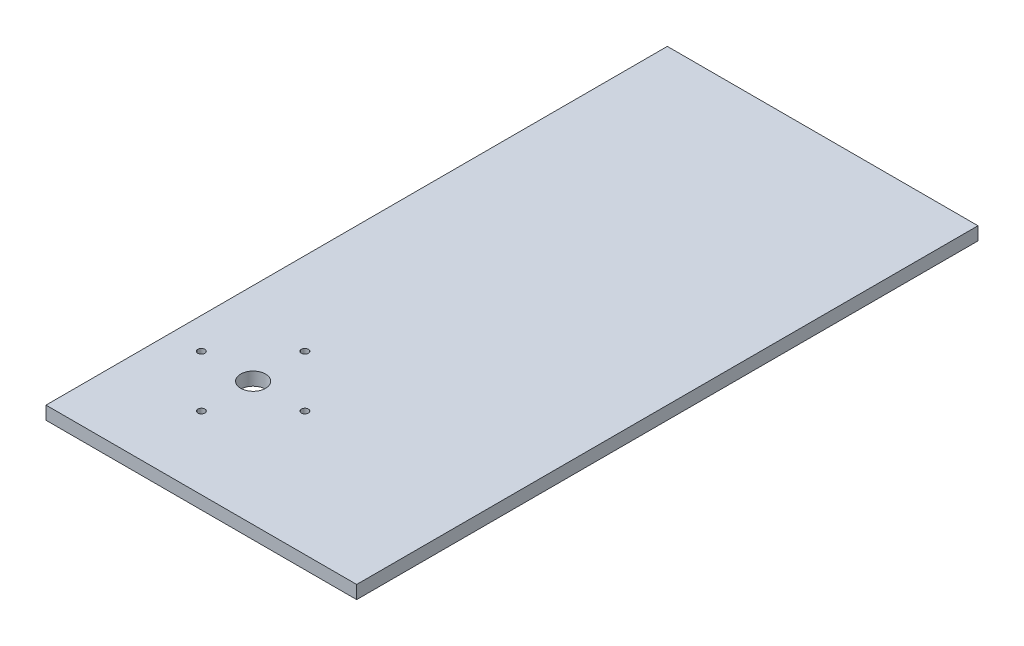
from build123d import *

# Parameters (mm, degrees)
SKETCH1_W           = 150
SKETCH1_H           = 300
BOSS_EXTRUDE1_DEPTH = 6.35
SKETCH2_R           = 6
SKETCH2_R_2         = 1.7
CUT_EXTRUDE1_DEPTH  = 168.825273722


with BuildPart() as part:
    # Sketch1 → Boss-Extrude1 (new body)
    with BuildSketch(Plane(origin=(0, 0, 0), x_dir=(1, 0, 0), z_dir=(0, 1, 0))):
        Rectangle(SKETCH1_W, SKETCH1_H)
    extrude(amount=BOSS_EXTRUDE1_DEPTH)

    # Sketch2 → Cut-Extrude1 (cut, through all)
    with BuildSketch(Plane(origin=(0, 6.35, 0), x_dir=(1, 0, 0), z_dir=(0, 1, 0))):
        with Locations((-35, -90)):
            Circle(SKETCH2_R)
        with Locations((-35, -65)):
            Circle(SKETCH2_R_2)
        with Locations((-10, -90)):
            Circle(SKETCH2_R_2)
        with Locations((-35, -115)):
            Circle(SKETCH2_R_2)
        with Locations((-60, -90)):
            Circle(SKETCH2_R_2)
    extrude(amount=-CUT_EXTRUDE1_DEPTH, mode=Mode.SUBTRACT)


solid = part.part
